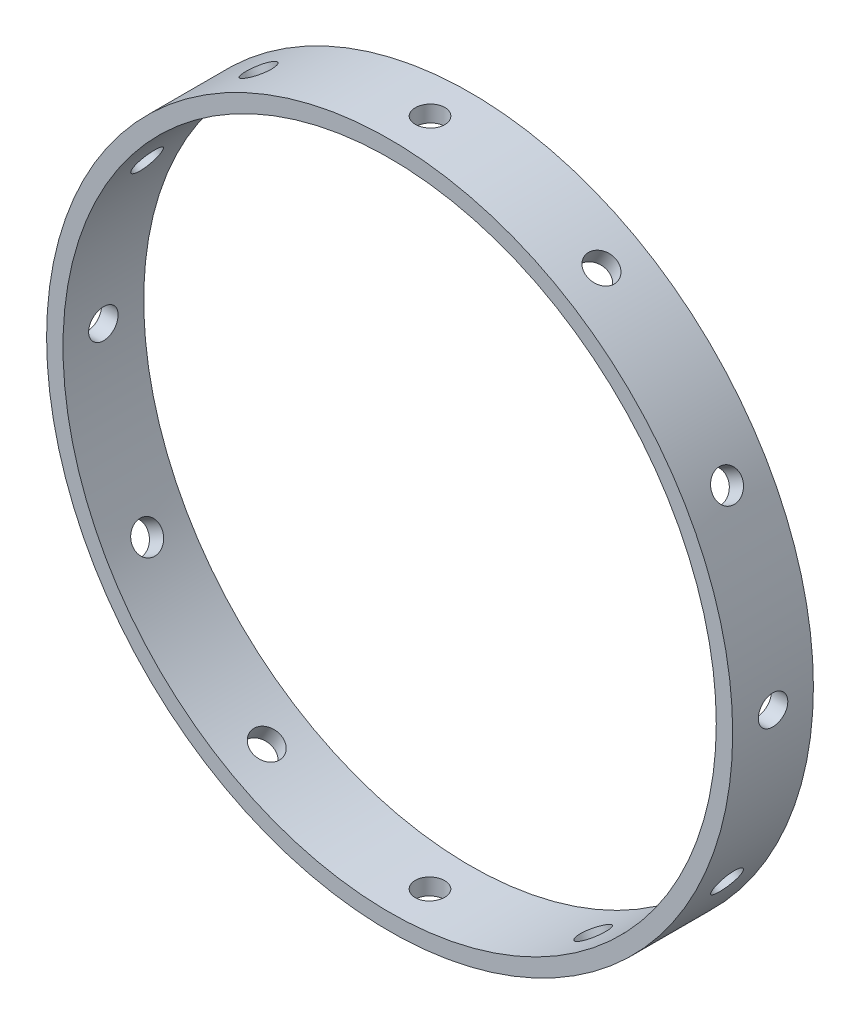
from build123d import *

# Parameters (mm, degrees)
SKETCH1_R           = 80.9625
SKETCH1_R_2         = 77.089
BOSS_EXTRUDE1_DEPTH = 19.05
SKETCH2_R           = 3.478244762
CUT_EXTRUDE1_DEPTH  = 117.072198706
CIRPATTERN1_COUNT   = 12


with BuildPart() as part:
    # Sketch1 → Boss-Extrude1 (new body)
    with BuildSketch(Plane.XY):
        Circle(SKETCH1_R)
        Circle(SKETCH1_R_2, mode=Mode.SUBTRACT)
    extrude(amount=BOSS_EXTRUDE1_DEPTH)

    # Sketch2 → Cut-Extrude1 (cut, through all)
    with BuildSketch(Plane(origin=(0, 0, 0), x_dir=(1, 0, 0), z_dir=(0, 1, 0))):
        with Locations((0, -9.525)):
            Circle(SKETCH2_R)
    cut_extrude1 = extrude(amount=-CUT_EXTRUDE1_DEPTH, mode=Mode.SUBTRACT)

    # CirPattern1: Cut-Extrude1 ×12 about axis
    cirpattern1_axis = Axis((0, 0, 2.080715754), (0, 0, 1))
    for i in range(1, CIRPATTERN1_COUNT):
        add(cut_extrude1.rotate(cirpattern1_axis, i * 360 / CIRPATTERN1_COUNT), mode=Mode.SUBTRACT)


solid = part.part
